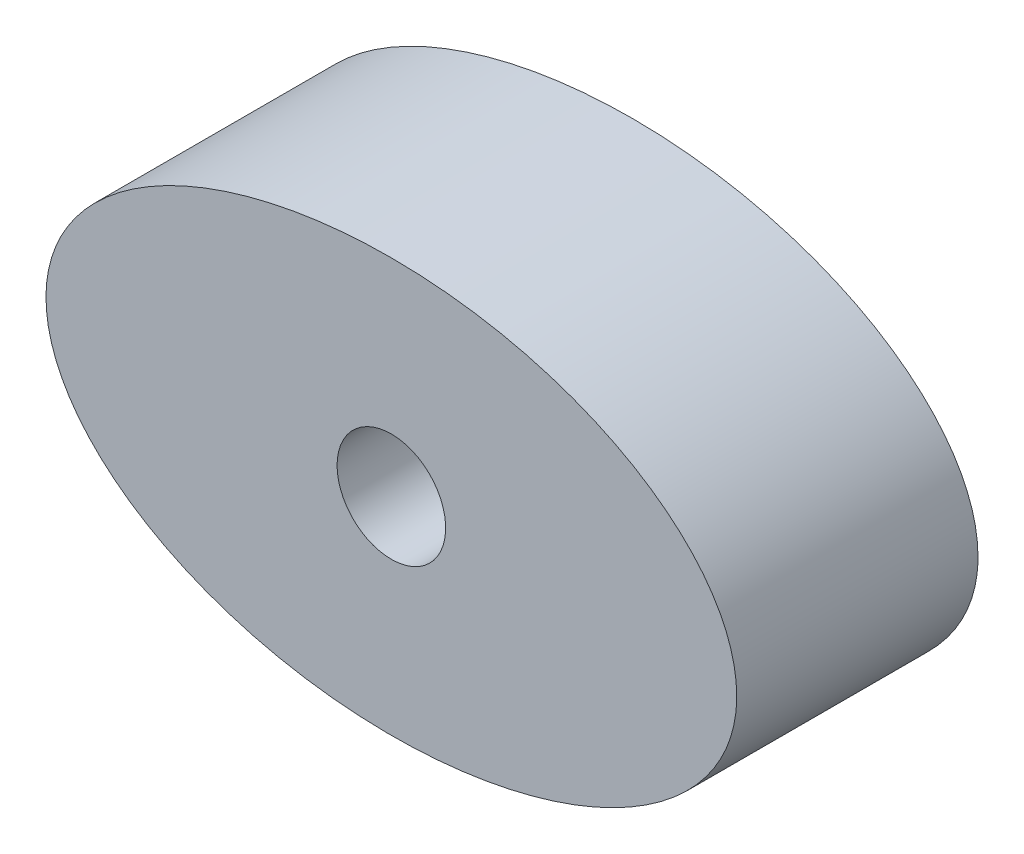
from build123d import *

# Parameters (mm, degrees)
ESQUISSE1_RX            = 21.209
ESQUISSE1_RY            = 12.7
BOSS_EXTRU_1_DEPTH      = 14.81582
ESQUISSE2_R             = 3.33375
ENL_V_MAT_EXTRU_1_DEPTH = 29.820482357


with BuildPart() as part:
    # Esquisse1 → Boss.-Extru.1 (new body)
    with BuildSketch(Plane.XY):
        with Locations(Location((0, 0), (0, 0, 0))):
            Ellipse(ESQUISSE1_RX, ESQUISSE1_RY)
    extrude(amount=BOSS_EXTRU_1_DEPTH)

    # Esquisse2 → Enlèv. mat.-Extru.1 (cut, through all)
    with BuildSketch(Plane(origin=(0, 0, 0), x_dir=(-1, 0, 0), z_dir=(0, 0, -1))):
        Circle(ESQUISSE2_R)
    extrude(amount=-ENL_V_MAT_EXTRU_1_DEPTH, mode=Mode.SUBTRACT)


solid = part.part
